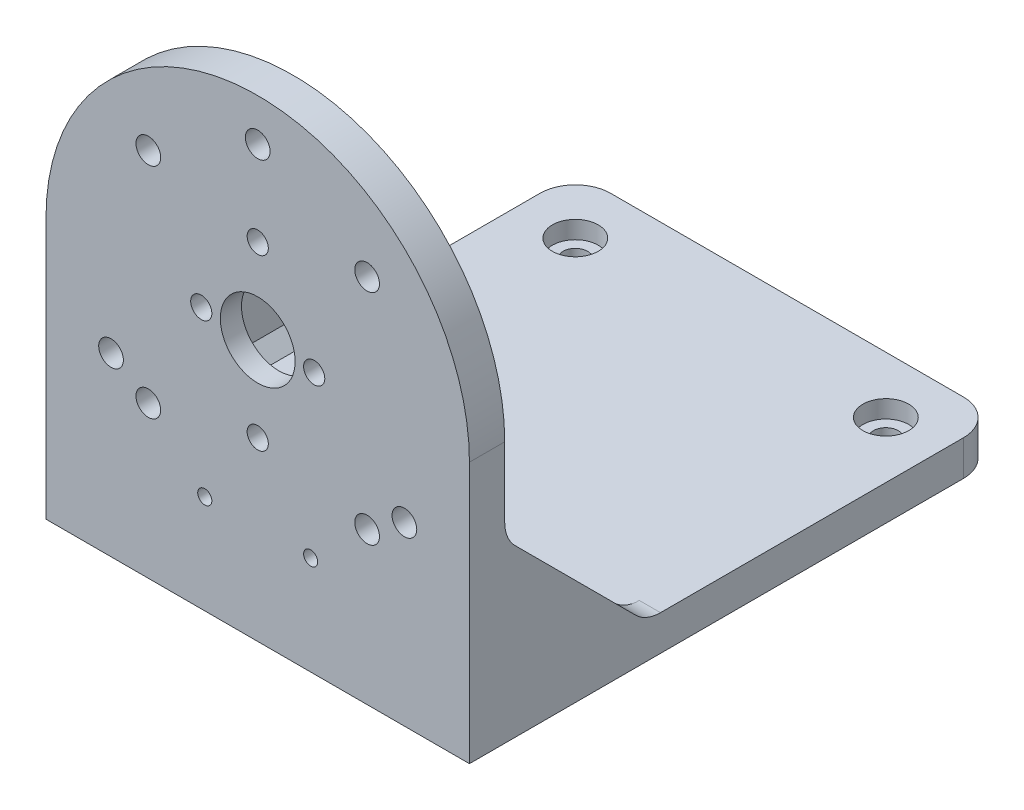
from build123d import *

# Parameters (mm, degrees)
ESBO_O1_R                = 5.3
RESSALTO_EXTRUS_O1_DEPTH = 5
ESBO_O2_W                = 60
ESBO_O2_H                = 5
RESSALTO_EXTRUS_O2_DEPTH = 70
ESBO_O5_R                = 16
CORTE_EXTRUS_O2_DEPTH    = 2
FILETE1_R                = 5
ESBO_O3_R                = 1.75
CORTE_EXTRUS_O1_DEPTH    = 89.848185125
RESSALTO_EXTRUS_O3_DEPTH = 3
FILETE2_R                = 5
ESBO_O6_R                = 1.5
CORTE_EXTRUS_O3_DEPTH    = 89.848185125
ESBO_O8_R                = 1.5
CORTE_EXTRUS_O4_DEPTH    = 89.848185125
ESBO_O9_R                = 1.75
CORTE_EXTRUS_O5_DEPTH    = 89.848185125
ESBO_O10_R               = 1.75
CORTE_EXTRUS_O6_DEPTH    = 99.203869578
ESBO_O11_R               = 3.25
CORTE_EXTRUS_O7_DEPTH    = 2.5
ESBO_O13_W               = 13
ESBO_O13_H               = 20
ESBO_O13_R               = 1.25
RESSALTO_EXTRUS_O4_DEPTH = 18
ESBO_O18_R               = 1
CORTE_EXTRUS_O9_DEPTH    = 4
CHANFRO1_SIZE            = 2


with BuildPart() as part:
    # Esboço1 → Ressalto-extrusão1 (new body)
    with BuildSketch(Plane.XY):
        with BuildLine():
            Line((-30, 0), (-30, -37))
            Line((-30, -37), (30, -37))
            Line((30, -37), (30, 0))
            ThreePointArc((30, 0), (0, 30), (-30, 0))
        make_face()
        Circle(ESBO_O1_R, mode=Mode.SUBTRACT)
    extrude(amount=RESSALTO_EXTRUS_O1_DEPTH)

    # Esboço2 → Ressalto-extrusão2 (add)
    with BuildSketch(Plane(origin=(0, 0, 0), x_dir=(-1, 0, 0), z_dir=(0, 0, -1))):
        with Locations((0, -34.5)):
            Rectangle(ESBO_O2_W, ESBO_O2_H)
    extrude(amount=RESSALTO_EXTRUS_O2_DEPTH)

    # Esboço5 → Corte-extrusão2 (cut)
    with BuildSketch(Plane(origin=(0, 0, 0), x_dir=(-1, 0, 0), z_dir=(0, 0, -1))):
        Circle(ESBO_O5_R)
    extrude(amount=-CORTE_EXTRUS_O2_DEPTH, mode=Mode.SUBTRACT)

    # Filete1
    filete1_edges = [part.edges().sort_by_distance(p)[0] for p in [
        (30, -34.5, -70),
        (-30, -34.5, -70),
    ]]
    fillet(filete1_edges, radius=FILETE1_R)

    # Esboço3 → Corte-extrusão1 (cut, through all)
    with BuildSketch(Plane.XY.offset(5)):
        with Locations((0, 24)):
            Circle(ESBO_O3_R)
        with Locations((20.784609691, -12)):
            Circle(ESBO_O3_R)
        with Locations((-20.784609691, -12)):
            Circle(ESBO_O3_R)
    extrude(amount=-CORTE_EXTRUS_O1_DEPTH, mode=Mode.SUBTRACT)

    # Esboço4 → Ressalto-extrusão3 (add)
    with BuildSketch(Plane.ZY.offset(30)):
        Polygon((-20, -32), (0, -12), (0, -32), align=None)
    ressalto_extrus_o3 = extrude(amount=-RESSALTO_EXTRUS_O3_DEPTH)

    # Espelhar1: Ressalto-extrusão3 across plane
    add(ressalto_extrus_o3.mirror(Plane(origin=(0, 0, 0), x_dir=(0, 0, 1), z_dir=(1, 0, 0))))

    # Filete2
    filete2_edges = [part.edges().sort_by_distance(p)[0] for p in [
        (-28.5, -32, -20),
        (-28.5, -12, 0),
        (28.5, -32, -20),
        (28.5, -12, 0),
    ]]
    fillet(filete2_edges, radius=FILETE2_R)

    # Esboço6 → Corte-extrusão3 (cut, through all)
    with BuildSketch(Plane.XY.offset(5)):
        with Locations((-8, 0)):
            Circle(ESBO_O6_R)
        with Locations(Location((8, 0, 0), (0, 0, 180))):
            Circle(ESBO_O6_R)
    extrude(amount=-CORTE_EXTRUS_O3_DEPTH, mode=Mode.SUBTRACT)

    # Esboço8 → Corte-extrusão4 (cut, through all)
    with BuildSketch(Plane.XY.offset(5)):
        with Locations((0, 12)):
            Circle(ESBO_O8_R)
        with Locations(Location((0, -12, 0), (0, 0, 180))):
            Circle(ESBO_O8_R)
    extrude(amount=-CORTE_EXTRUS_O4_DEPTH, mode=Mode.SUBTRACT)

    # Esboço9 → Corte-extrusão5 (cut, through all)
    with BuildSketch(Plane.XY.offset(5)):
        with Locations((-15.5, 15.5)):
            Circle(ESBO_O9_R)
        with Locations((15.5, 15.5)):
            Circle(ESBO_O9_R)
        with Locations((15.5, -15.5)):
            Circle(ESBO_O9_R)
        with Locations((-15.5, -15.5)):
            Circle(ESBO_O9_R)
    extrude(amount=-CORTE_EXTRUS_O5_DEPTH, mode=Mode.SUBTRACT)

    # Esboço10 → Corte-extrusão6 (cut, through all)
    with BuildSketch(Plane(origin=(0, -32, 0), x_dir=(1, 0, 0), z_dir=(0, 1, 0))):
        with Locations(Location((0, 8, 0), (0, 0, 270))):
            Circle(ESBO_O10_R)
        with Locations(Location((-22, 62, 0), (0, 0, 270))):
            Circle(ESBO_O10_R)
        with Locations(Location((22, 62, 0), (0, 0, 270))):
            Circle(ESBO_O10_R)
    extrude(amount=-CORTE_EXTRUS_O6_DEPTH, mode=Mode.SUBTRACT)

    # Esboço11 → Corte-extrusão7 (cut)
    with BuildSketch(Plane(origin=(0, -32, 0), x_dir=(1, 0, 0), z_dir=(0, 1, 0))):
        with Locations(Location((-22, 62, 0), (0, 0, 270))):
            Circle(ESBO_O11_R)
        with Locations(Location((22, 62, 0), (0, 0, 270))):
            Circle(ESBO_O11_R)
        with Locations(Location((0, 8, 0), (0, 0, 270))):
            Circle(ESBO_O11_R)
    extrude(amount=-CORTE_EXTRUS_O7_DEPTH, mode=Mode.SUBTRACT)

    # Esboço13 → Ressalto-extrusão4 (add)
    with BuildSketch(Plane(origin=(0, -37, 0), x_dir=(1, 0, 0), z_dir=(0, 1, 0))):
        with Locations((-36.5, 22)):
            Rectangle(ESBO_O13_W, ESBO_O13_H)
        with Locations(Location((-36.5, 18, 0), (0, 0, 90))):
            Circle(ESBO_O13_R, mode=Mode.SUBTRACT)
        with Locations(Location((-36.5, 26, 0), (0, 0, 90))):
            Circle(ESBO_O13_R, mode=Mode.SUBTRACT)
    extrude(amount=RESSALTO_EXTRUS_O4_DEPTH)

    # Esboço18 → Corte-extrusão9 (cut)
    with BuildSketch(Plane.XY.offset(5)):
        with Locations((-7.5, -23)):
            Circle(ESBO_O18_R)
        with Locations((7.5, -23)):
            Circle(ESBO_O18_R)
    extrude(amount=-CORTE_EXTRUS_O9_DEPTH, mode=Mode.SUBTRACT)

    # Chanfro1
    # the kernel refuses this chamfer: 2 mm, written as the material it adds along each edge
    with BuildSketch(Plane(origin=(-30, -32, -16.927701836), x_dir=(0.9996219169112968, -0.027495876610585647, 0), z_dir=(0, 0, -1))) as chanfro1_piece_1:
        Polygon((CHANFRO1_SIZE * 0.999621916911, -CHANFRO1_SIZE * 0.0274958766106), (-CHANFRO1_SIZE * 0.0274958766106, -CHANFRO1_SIZE * 0.999621916911), (0, 0), align=None)
    extrude(amount=15.072298164)


solid = part.part
